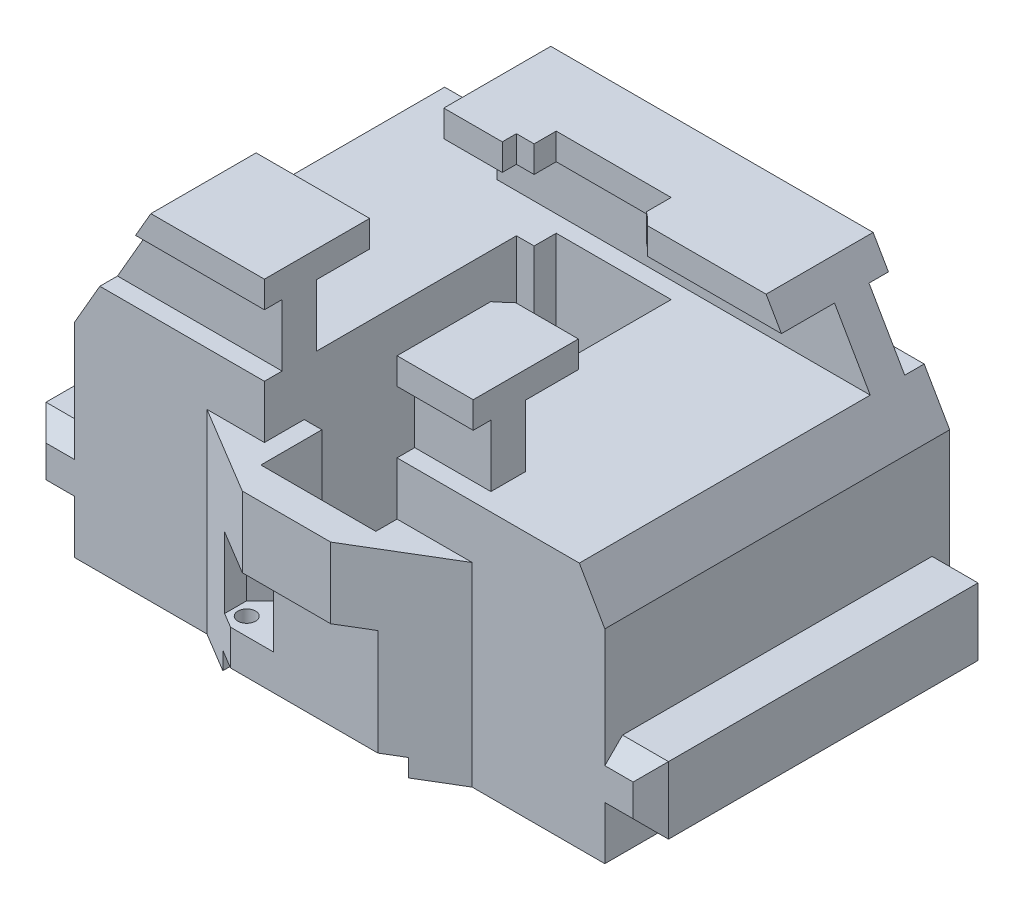
from build123d import *
from OCP.BRepFilletAPI import BRepFilletAPI_MakeChamfer

# Parameters (mm, degrees)
SKETCH1_W                = 60
SKETCH1_H                = 45
BOSS_EXTRUDE1_DEPTH      = 30
SKETCH2_W                = 6.5
SKETCH2_H                = 16
CUT_EXTRUDE1_DEPTH       = 20
CHAMFER1_SIZE            = 5
CHAMFER1_SIZE2           = 0.437443318
CHAMFER2_SIZE            = 5
CHAMFER2_SIZE2           = 5.958767963
CUT_EXTRUDE2_DEPTH       = 10
CHAMFER3_SIZE            = 3
CHAMFER3_SIZE2           = 1.5
CUT_EXTRUDE3_REACH       = 82.777
SKETCH6_W                = 28
SKETCH6_H                = 31
CUT_EXTRUDE4_DEPTH       = 1
BOSS_EXTRUDE2_DEPTH      = 22
CUT_EXTRUDE5_REACH       = 80.16
SKETCH7_W                = 13
SKETCH7_H                = 23.4
CUT_EXTRUDE6_REACH       = 95.485
CUT_EXTRUDE6_START       = -15.6
SKETCH8_W                = 13
SKETCH8_H                = 5
CUT_EXTRUDE7_REACH       = 80.16
BOSS_EXTRUDE3_DEPTH      = 16
CHAMFER6_SIZE            = 15
CHAMFER6_SIZE2           = 8.660254038
SKETCH14_R               = 11
CUT_EXTRUDE8_DEPTH       = 10
SKETCH15_W               = 70
SKETCH15_H               = 15
CUT_EXTRUDE9_DEPTH       = 10
CUT_EXTRUDE10_DEPTH      = 71.3651192
CUT_EXTRUDE10_DEPTH_BACK = 71.3651192
SKETCH16_W               = 6
SKETCH16_H               = 7
SKETCH16_W_2             = 2
CUT_EXTRUDE11_DEPTH      = 71.3651192
CUT_EXTRUDE11_DEPTH_BACK = 71.3651192
SKETCH17_W               = 6
SKETCH17_H               = 7
SKETCH17_W_2             = 2.2
SKETCH18_W               = 21
SKETCH18_H               = 8
CUT_EXTRUDE12_DEPTH      = 2
SKETCH19_R               = 1
SKETCH19_W               = 18.34106835
SKETCH19_H               = 5.189180314
CUT_EXTRUDE13_DEPTH      = 12
CUT_EXTRUDE14_REACH      = 80.957
SKETCH20_W               = 2
SKETCH20_H               = 8
CUT_EXTRUDE15_REACH      = 86.077
SKETCH21_W               = 16.800854114
SKETCH21_H               = 23.16859679
SKETCH21_W_2             = 25.313746617
SKETCH21_H_2             = 27.258932471
SKETCH22_W               = 5.2
SKETCH22_H               = 7.6
BOSS_EXTRUDE4_DEPTH      = 39
CHAMFER7_SIZE            = 2
SKETCH23_W               = 6.5
SKETCH23_H               = 8
CUT_EXTRUDE16_DEPTH      = 3
CHAMFER8_SIZE            = 2


with BuildPart() as part:
    # Sketch1 → Boss-Extrude1 (new body)
    with BuildSketch(Plane(origin=(0, 0, 0), x_dir=(1, 0, 0), z_dir=(0, 1, 0))):
        with Locations((-30, 22.5)):
            Rectangle(SKETCH1_W, SKETCH1_H)
    extrude(amount=BOSS_EXTRUDE1_DEPTH)

    # Sketch2 → Cut-Extrude1 (cut)
    with BuildSketch(Plane(origin=(0, 0, 0), x_dir=(-1, 0, 0), z_dir=(0, -1, 0))):
        with Locations((47.5, 21)):
            Rectangle(SKETCH2_W, SKETCH2_H)
        with Locations((13, 21)):
            Rectangle(SKETCH2_W, SKETCH2_H)
    extrude(amount=-CUT_EXTRUDE1_DEPTH, mode=Mode.SUBTRACT)

    # Chamfer1: one chamfer whose edges measure the first distance from different faces: ONE call of the kernel's chamfer builder (chamfer() names one face for all edges)
    chamfer1_edges_1 = [part.edges().sort_by_distance(p)[0] for p in [
        (-50.75, 20, -21),
    ]]
    chamfer1_side_1 = [part.faces().sort_by_distance(p)[0] for p in [
        (-50.75, 10, -21),
    ]]
    chamfer1_edges_2 = [part.edges().sort_by_distance(p)[0] for p in [
        (-44.25, 20, -21),
    ]]
    chamfer1_side_2 = [part.faces().sort_by_distance(p)[0] for p in [
        (-44.25, 10, -21),
    ]]
    chamfer1_edges_3 = [part.edges().sort_by_distance(p)[0] for p in [
        (-16.25, 20, -21),
    ]]
    chamfer1_side_3 = [part.faces().sort_by_distance(p)[0] for p in [
        (-16.25, 10, -21),
    ]]
    chamfer1_edges_4 = [part.edges().sort_by_distance(p)[0] for p in [
        (-9.75, 20, -21),
    ]]
    chamfer1_side_4 = [part.faces().sort_by_distance(p)[0] for p in [
        (-9.75, 10, -21),
    ]]
    chamfer1 = BRepFilletAPI_MakeChamfer(part.part.solid().wrapped)
    for e in chamfer1_edges_1:
        chamfer1.Add(CHAMFER1_SIZE, CHAMFER1_SIZE2, e.wrapped, chamfer1_side_1[0].wrapped)  # the first distance lies on this face
    for e in chamfer1_edges_2:
        chamfer1.Add(CHAMFER1_SIZE, CHAMFER1_SIZE2, e.wrapped, chamfer1_side_2[0].wrapped)  # the first distance lies on this face
    for e in chamfer1_edges_3:
        chamfer1.Add(CHAMFER1_SIZE, CHAMFER1_SIZE2, e.wrapped, chamfer1_side_3[0].wrapped)  # the first distance lies on this face
    for e in chamfer1_edges_4:
        chamfer1.Add(CHAMFER1_SIZE, CHAMFER1_SIZE2, e.wrapped, chamfer1_side_4[0].wrapped)  # the first distance lies on this face
    add(Compound.cast(chamfer1.Shape()), mode=Mode.REPLACE)

    # Chamfer2: one chamfer whose edges measure the first distance from different faces: ONE call of the kernel's chamfer builder (chamfer() names one face for all edges)
    chamfer2_edges_1 = [part.edges().sort_by_distance(p)[0] for p in [
        (-47.5, 20, -29),
    ]]
    chamfer2_side_1 = [part.faces().sort_by_distance(p)[0] for p in [
        (-47.5, 9.857394508, -29),
    ]]
    chamfer2_edges_2 = [part.edges().sort_by_distance(p)[0] for p in [
        (-13, 20, -29),
    ]]
    chamfer2_side_2 = [part.faces().sort_by_distance(p)[0] for p in [
        (-13, 9.857394508, -29),
    ]]
    chamfer2_edges_3 = [part.edges().sort_by_distance(p)[0] for p in [
        (-13, 20, -13),
    ]]
    chamfer2_side_3 = [part.faces().sort_by_distance(p)[0] for p in [
        (-13, 9.857394508, -13),
    ]]
    chamfer2_edges_4 = [part.edges().sort_by_distance(p)[0] for p in [
        (-47.5, 20, -13),
    ]]
    chamfer2_side_4 = [part.faces().sort_by_distance(p)[0] for p in [
        (-47.5, 9.857394508, -13),
    ]]
    chamfer2 = BRepFilletAPI_MakeChamfer(part.part.solid().wrapped)
    for e in chamfer2_edges_1:
        chamfer2.Add(CHAMFER2_SIZE, CHAMFER2_SIZE2, e.wrapped, chamfer2_side_1[0].wrapped)  # the first distance lies on this face
    for e in chamfer2_edges_2:
        chamfer2.Add(CHAMFER2_SIZE, CHAMFER2_SIZE2, e.wrapped, chamfer2_side_2[0].wrapped)  # the first distance lies on this face
    for e in chamfer2_edges_3:
        chamfer2.Add(CHAMFER2_SIZE, CHAMFER2_SIZE2, e.wrapped, chamfer2_side_3[0].wrapped)  # the first distance lies on this face
    for e in chamfer2_edges_4:
        chamfer2.Add(CHAMFER2_SIZE, CHAMFER2_SIZE2, e.wrapped, chamfer2_side_4[0].wrapped)  # the first distance lies on this face
    add(Compound.cast(chamfer2.Shape()), mode=Mode.REPLACE)

    # Sketch4 → Cut-Extrude2 (cut)
    with BuildSketch(Plane(origin=(0, 0, -45), x_dir=(-1, 0, 0), z_dir=(0, 0, -1))):
        with BuildLine():
            Line((11.5, 0), (28.3, 0))
            ThreePointArc((28.3, 0), (34.080602383, 6.276082414), (42.61191296, 6.13008847))
            ThreePointArc((42.61191296, 6.13008847), (47.088831578, 7.478397416), (46.230644896, 12.074510224))
            ThreePointArc((46.230644896, 12.074510224), (25.608734298, 15.404376803), (11.5, 0))
        make_face()
    extrude(amount=-CUT_EXTRUDE2_DEPTH, mode=Mode.SUBTRACT)

    # Chamfer3
    chamfer3_edges = [part.edges().sort_by_distance(p)[0] for p in [
        (-50.75, 0, -21),
        (-47.5, 0, -29),
        (-44.25, 0, -21),
        (-47.5, 0, -13),
        (-16.25, 0, -21),
        (-13, 0, -29),
        (-9.75, 0, -21),
        (-13, 0, -13),
    ]]
    chamfer3_side = [part.faces().sort_by_distance(p)[0] for p in [
        (-30.707745267, 0, -21.36919105),
    ]]
    chamfer(chamfer3_edges, length=CHAMFER3_SIZE, length2=CHAMFER3_SIZE2, reference=chamfer3_side[0])

    # Sketch5 → Cut-Extrude3 (cut, up to next)
    with BuildSketch(Plane.ZY.offset(60), mode=Mode.PRIVATE) as cut_extrude3_sk1:
        Polygon((-45, 30), (0, 30), (0, 0), (-6, 0), (-6, 22), (-45, 22), align=None)
    cut_extrude3_tool1 = extrude(cut_extrude3_sk1.sketch, amount=-CUT_EXTRUDE3_REACH, mode=Mode.PRIVATE) & part.part
    add(cut_extrude3_tool1.solids().sort_by_distance((-60, 29.459167, -22.5))[0], mode=Mode.SUBTRACT)

    # Sketch6 → Cut-Extrude4 (cut)
    with BuildSketch(Plane(origin=(0, 0, 0), x_dir=(-1, 0, 0), z_dir=(0, -1, 0))):
        with Locations((30.25, 21.5)):
            Rectangle(SKETCH6_W, SKETCH6_H)
    extrude(amount=-CUT_EXTRUDE4_DEPTH, mode=Mode.SUBTRACT)

    # Sketch12 → Boss-Extrude2 (add)
    with BuildSketch(Plane.XZ):
        Polygon((-45, -6), (-35, 0), (-25, 0), (-15, -6), align=None)
    extrude(amount=-BOSS_EXTRUDE2_DEPTH)

    # Sketch7 → Cut-Extrude5 (cut, up to next)
    with BuildSketch(Plane(origin=(0, 22, 0), x_dir=(1, 0, 0), z_dir=(0, 1, 0)), mode=Mode.PRIVATE) as cut_extrude5_sk1:
        with Locations((-30, 20.3)):
            Rectangle(SKETCH7_W, SKETCH7_H)
    cut_extrude5_tool1 = extrude(cut_extrude5_sk1.sketch, amount=-CUT_EXTRUDE5_REACH, mode=Mode.PRIVATE) & part.part
    add(cut_extrude5_tool1.solids().sort_by_distance((-30, 22, -20.3))[0], mode=Mode.SUBTRACT)

    # Sketch8 → Cut-Extrude6 (cut, up to next)
    with BuildSketch(Plane.XZ.offset(-1).offset(CUT_EXTRUDE6_START), mode=Mode.PRIVATE) as cut_extrude6_sk1:
        with Locations((-30, -6.1)):
            Rectangle(SKETCH8_W, SKETCH8_H)
    cut_extrude6_tool1 = extrude(cut_extrude6_sk1.sketch, amount=-CUT_EXTRUDE6_REACH, mode=Mode.PRIVATE) & part.part
    # Sketch8 → Cut-Extrude6 (cut, up to next)
    with BuildSketch(Plane.XZ.offset(-1).offset(CUT_EXTRUDE6_START), mode=Mode.PRIVATE) as cut_extrude6_sk2:
        with Locations((-30, -34.5)):
            Rectangle(SKETCH8_W, SKETCH8_H)
    cut_extrude6_tool2 = extrude(cut_extrude6_sk2.sketch, amount=-CUT_EXTRUDE6_REACH, mode=Mode.PRIVATE) & part.part
    add(cut_extrude6_tool1.solids().sort_by_distance((-30, 16.6, -6.1))[0], mode=Mode.SUBTRACT)
    add(cut_extrude6_tool2.solids().sort_by_distance((-30, 16.6, -34.5))[0], mode=Mode.SUBTRACT)

    # Sketch10 → Cut-Extrude7 (cut, up to next)
    with BuildSketch(Plane(origin=(0, 22, 0), x_dir=(1, 0, 0), z_dir=(0, 1, 0)), mode=Mode.PRIVATE) as cut_extrude7_sk1:
        Polygon((-27.5, 32), (-27.5, 34.5), (-38.5, 34.5), (-38.5, 10.5), (-36.5, 10.5), (-36.5, 32), align=None)
    cut_extrude7_tool1 = extrude(cut_extrude7_sk1.sketch, amount=-CUT_EXTRUDE7_REACH, mode=Mode.PRIVATE) & part.part
    add(cut_extrude7_tool1.solids().sort_by_distance((-27.764008, 22, -33.25))[0], mode=Mode.SUBTRACT)

    # Sketch13 → Boss-Extrude3 (add)
    with BuildSketch(Plane(origin=(0, 22, 0), x_dir=(1, 0, 0), z_dir=(0, 1, 0))):
        Polygon((-60, 45), (0, 45), (0, 6), (-15, 6), (-23.5, 6), (-23.5, 37), (-36.5, 37), (-36.5, 34.5), (-38.5, 34.5), (-38.5, 6), (-60, 6), align=None)
    extrude(amount=BOSS_EXTRUDE3_DEPTH)

    # Chamfer6: one chamfer whose edges measure the first distance from different faces: ONE call of the kernel's chamfer builder (chamfer() names one face for all edges)
    chamfer6_edges_1 = [part.edges().sort_by_distance(p)[0] for p in [
        (-60, 38, -25.5),
    ]]
    chamfer6_side_1 = [part.faces().sort_by_distance(p)[0] for p in [
        (-60, 19, -25.5),
    ]]
    chamfer6_edges_2 = [part.edges().sort_by_distance(p)[0] for p in [
        (0, 38, -25.5),
    ]]
    chamfer6_side_2 = [part.faces().sort_by_distance(p)[0] for p in [
        (0, 19, -25.5),
    ]]
    chamfer6 = BRepFilletAPI_MakeChamfer(part.part.solid().wrapped)
    for e in chamfer6_edges_1:
        chamfer6.Add(CHAMFER6_SIZE, CHAMFER6_SIZE2, e.wrapped, chamfer6_side_1[0].wrapped)  # the first distance lies on this face
    for e in chamfer6_edges_2:
        chamfer6.Add(CHAMFER6_SIZE, CHAMFER6_SIZE2, e.wrapped, chamfer6_side_2[0].wrapped)  # the first distance lies on this face
    add(Compound.cast(chamfer6.Shape()), mode=Mode.REPLACE)

    # Sketch14 → Cut-Extrude8 (cut)
    with BuildSketch(Plane(origin=(0, 38, 0), x_dir=(1, 0, 0), z_dir=(0, 1, 0))):
        with Locations((-30.1, 25.4)):
            Circle(SKETCH14_R)
    extrude(amount=-CUT_EXTRUDE8_DEPTH, mode=Mode.SUBTRACT)

    # Sketch15 → Cut-Extrude9 (cut)
    with BuildSketch(Plane(origin=(0, 38, 0), x_dir=(1, 0, 0), z_dir=(0, 1, 0))):
        with Locations((-30.1, 25.4)):
            Rectangle(SKETCH15_W, SKETCH15_H)
    extrude(amount=-CUT_EXTRUDE9_DEPTH, mode=Mode.SUBTRACT)

    # Sketch16 → Cut-Extrude10 (cut, two sides: drawn at the far end of the back side and taken through both)
    with BuildSketch(Plane(origin=(-38.5, 0, 0), x_dir=(0, 0, -1), z_dir=(1, 0, 0)).offset(-CUT_EXTRUDE10_DEPTH_BACK)):
        with Locations((14.9, 31.5)):
            Rectangle(SKETCH16_W, SKETCH16_H)
        with Locations((7, 31.5)):
            Rectangle(SKETCH16_W_2, SKETCH16_H)
    extrude(amount=CUT_EXTRUDE10_DEPTH + CUT_EXTRUDE10_DEPTH_BACK, mode=Mode.SUBTRACT)

    # Sketch17 → Cut-Extrude11 (cut, two sides: drawn at the far end of the back side and taken through both)
    with BuildSketch(Plane(origin=(-38.5, 0, 0), x_dir=(0, 0, -1), z_dir=(1, 0, 0)).offset(-CUT_EXTRUDE11_DEPTH_BACK)):
        with Locations((35.9, 31.5)):
            Rectangle(SKETCH17_W, SKETCH17_H)
        with Locations((43.9, 31.5)):
            Rectangle(SKETCH17_W_2, SKETCH17_H)
    extrude(amount=CUT_EXTRUDE11_DEPTH + CUT_EXTRUDE11_DEPTH_BACK, mode=Mode.SUBTRACT)

    # Sketch18 → Cut-Extrude12 (cut)
    with BuildSketch(Plane.XZ):
        with Locations((-30, -2)):
            Rectangle(SKETCH18_W, SKETCH18_H)
    extrude(amount=-CUT_EXTRUDE12_DEPTH, mode=Mode.SUBTRACT)

    # Sketch19 → Cut-Extrude13 (cut)
    with BuildSketch(Plane.XZ.offset(-2)):
        with Locations(Location((-38.5, -4, 0), (0, 0, 270))):
            Circle(SKETCH19_R)
        with Locations(Location((-22.5, -4, 0), (0, 0, 270))):
            Circle(SKETCH19_R)
        with Locations((-30, 0.594590157)):
            Rectangle(SKETCH19_W, SKETCH19_H)
    extrude(amount=-CUT_EXTRUDE13_DEPTH, mode=Mode.SUBTRACT)

    # Sketch20 → Cut-Extrude14 (cut, up to next)
    with BuildSketch(Plane(origin=(0, 0, -10.5), x_dir=(-1, 0, 0), z_dir=(0, 0, -1)), mode=Mode.PRIVATE) as cut_extrude14_sk1:
        with Locations((37.5, 10)):
            Rectangle(SKETCH20_W, SKETCH20_H)
    cut_extrude14_tool1 = extrude(cut_extrude14_sk1.sketch, amount=-CUT_EXTRUDE14_REACH, mode=Mode.PRIVATE) & part.part
    add(cut_extrude14_tool1.solids().sort_by_distance((-37.5, 10, -10.5))[0], mode=Mode.SUBTRACT)

    # Cut-Extrude15: up to this face of the body (flat: up to its plane)
    cut_extrude15_end = Plane(part.part.faces().sort_by_distance((-30, 28, -43.9))[0])
    # Sketch21 → Cut-Extrude15 (cut, up to the picked face)
    with BuildSketch(Plane(origin=(0, 38, 0), x_dir=(1, 0, 0), z_dir=(0, 1, 0)), mode=Mode.PRIVATE) as cut_extrude15_sk1:
        with Locations((-53.513675711, 40.114245734)):
            Rectangle(SKETCH21_W, SKETCH21_H)
    cut_extrude15_tool1 = split(extrude(cut_extrude15_sk1.sketch, amount=-CUT_EXTRUDE15_REACH, mode=Mode.PRIVATE), bisect_by=cut_extrude15_end, keep=Keep.BOTH, mode=Mode.PRIVATE)
    # Sketch21 → Cut-Extrude15 (cut, up to the picked face)
    with BuildSketch(Plane(origin=(0, 38, 0), x_dir=(1, 0, 0), z_dir=(0, 1, 0)), mode=Mode.PRIVATE) as cut_extrude15_sk2:
        with Locations((-2.229878037, 8.087664752)):
            Rectangle(SKETCH21_W_2, SKETCH21_H_2)
    cut_extrude15_tool2 = split(extrude(cut_extrude15_sk2.sketch, amount=-CUT_EXTRUDE15_REACH, mode=Mode.PRIVATE), bisect_by=cut_extrude15_end, keep=Keep.BOTH, mode=Mode.PRIVATE)
    add(cut_extrude15_tool1.solids().sort_by(Axis((-53.513676, 38, -40.114246), (0, -1, 0)))[0], mode=Mode.SUBTRACT)
    add(cut_extrude15_tool2.solids().sort_by(Axis((-2.229878, 38, -8.087665), (0, -1, 0)))[0], mode=Mode.SUBTRACT)

    # Sketch22 → Boss-Extrude4 (add)
    with BuildSketch(Plane(origin=(0, 0, -45), x_dir=(-1, 0, 0), z_dir=(0, 0, -1))):
        with Locations((-2.6, 7.8)):
            Rectangle(SKETCH22_W, SKETCH22_H)
        with Locations((62.6, 7.8)):
            Rectangle(SKETCH22_W, SKETCH22_H)
    extrude(amount=-BOSS_EXTRUDE4_DEPTH)

    # Chamfer7
    chamfer7_edges = [part.edges().sort_by_distance(p)[0] for p in [
        (2.6, 11.6, -45),
        (5.2, 7.8, -45),
        (2.6, 4, -45),
        (2.6, 4, -6),
        (5.2, 7.8, -6),
        (2.6, 11.6, -6),
        (-62.6, 4, -45),
        (-65.2, 7.8, -45),
        (-62.6, 11.6, -45),
        (-62.6, 11.6, -6),
        (-65.2, 7.8, -6),
        (-62.6, 4, -6),
    ]]
    chamfer(chamfer7_edges, length=CHAMFER7_SIZE)

    # Sketch23 → Cut-Extrude16 (cut)
    with BuildSketch(Plane.XY.offset(-2)):
        with Locations((-36.75, 10)):
            Rectangle(SKETCH23_W, SKETCH23_H)
    extrude(amount=-CUT_EXTRUDE16_DEPTH, mode=Mode.SUBTRACT)

    # Chamfer8
    # the kernel refuses this chamfer: 2 mm, written as the material it takes off along each edge
    with BuildSketch(Plane(origin=(-36.5, 6, -5), x_dir=(-0.027495876610585623, 0, -0.9996219169112968), z_dir=(0, 1, 0))) as chamfer8_piece_1:
        Polygon((CHAMFER8_SIZE * 0.999621916911, -CHAMFER8_SIZE * 0.0274958766106), (-CHAMFER8_SIZE * 0.0274958766106, -CHAMFER8_SIZE * 0.999621916911), (0, 0), align=None)
    extrude(amount=8, mode=Mode.SUBTRACT)
    with BuildSketch(Plane(origin=(-38.5, 6, -5), x_dir=(0.027495876610585647, 0, -0.9996219169112968), z_dir=(0, 1, 0))) as chamfer8_piece_2_section:
        Polygon((CHAMFER8_SIZE * 0.999621916911, CHAMFER8_SIZE * 0.0274958766106), (-CHAMFER8_SIZE * 0.0274958766106, CHAMFER8_SIZE * 0.999621916911), (0, 0), align=None)
    chamfer8_piece_2 = extrude(amount=8, mode=Mode.PRIVATE)
    chamfer8_piece_2 = split(chamfer8_piece_2, bisect_by=Plane(origin=(-40, 10, -5.70391822), z_dir=(1, 0, 0)), keep=Keep.TOP, mode=Mode.PRIVATE)
    add(chamfer8_piece_2, mode=Mode.SUBTRACT)


solid = part.part
